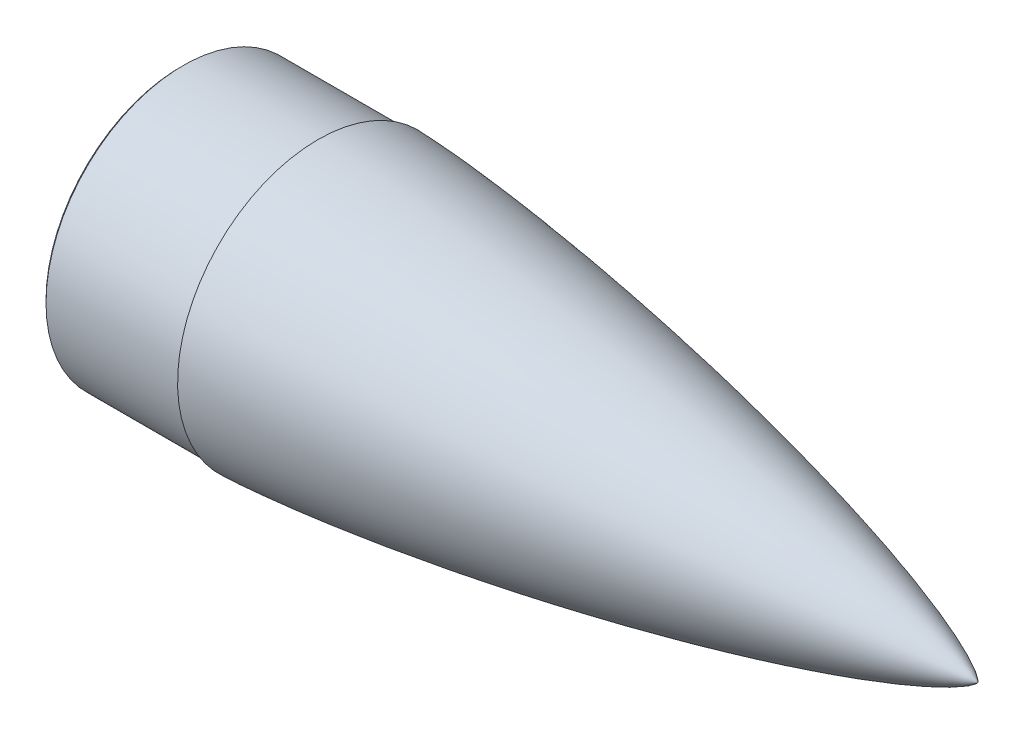
from build123d import *

# Parameters (mm, degrees)
CHAMFER1_SIZE = 1.5


with BuildPart() as part:
    # Sketch10 → Revolve1 (revolve)
    with BuildSketch(Plane.XY):
        with BuildLine():
            Line((11.112493743, 81.99983), (-84.604517473, 81.99983))
            Line((-84.604517473, 81.99983), (-84.604517473, 84.99983))
            Line((-84.604517473, 84.99983), (0.395312527, 84.99983))
            Line((0.395312527, 84.99983), (0.395312527, 86.99983))
            add(Edge.make_bspline(
                [(408.967251823, 0), (408.964913524, 0.013501739), (408.958040758, 0.039916077), (408.936520441, 0.090485698), (408.892222076, 0.174057132), (408.826281575, 0.275556803), (408.721696416, 0.415833756), (408.561101809, 0.605075245), (408.30561918, 0.87242415), (407.86966713, 1.275299562), (407.120955138, 1.885142115), (405.803773451, 2.82590185), (403.46240692, 4.287152794), (399.325294488, 6.531818454), (392.481146888, 9.758904649), (380.662076725, 14.628008466), (363.637187185, 20.711720382), (342.215241093, 27.476512989), (317.428462321, 34.49762647), (291.879335737, 41.10482439), (266.21046092, 47.228993169), (240.44548836, 52.933436777), (214.598861982, 58.255439009), (188.68089566, 63.217582693), (165.946174917, 67.253280679), (146.421982586, 70.493799722), (130.127893898, 73.044947468), (117.078590637, 74.994157933), (104.015464216, 76.84854079), (92.573263959, 78.384492045), (82.757139441, 79.635603973), (74.571340184, 80.632219902), (68.019260454, 81.400804211), (61.463723364, 82.139375899), (54.90469802, 82.84637726), (48.342159918, 83.519940506), (41.776057559, 84.15778717), (36.02754108, 84.682157239), (31.097921259, 85.105234912), (26.988317923, 85.438669825), (23.699666618, 85.693218594), (20.085807822, 85.958448038), (16.719873821, 86.189018485), (13.602098287, 86.386966779), (10.732704013, 86.554575744), (8.436635008, 86.678703291), (6.139997341, 86.792157585), (4.129892063, 86.879313264), (2.40653858, 86.944618982), (1.257348635, 86.979022496), (0.68269791, 86.99491462), (0.395312527, 86.99983)],
                knots=[0, 0, 0, 0, 0, 0.000130123, 0.000260245, 0.000520491, 0.000900391, 0.00128029, 0.001925099, 0.002881508, 0.004418208, 0.006927086, 0.011110697, 0.018279138, 0.03067276, 0.051704469, 0.08310228, 0.139908797, 0.202702513, 0.265496165, 0.328289682, 0.391083359, 0.453876973, 0.516670577, 0.579464197, 0.642257765, 0.673654596, 0.705051427, 0.736448267, 0.767845106, 0.799241874, 0.814940257, 0.830638641, 0.846337073, 0.862035505, 0.877733936, 0.893432368, 0.90913072, 0.924829072, 0.932678248, 0.940527424, 0.9483766, 0.956225776, 0.967169332, 0.97264111, 0.978112888, 0.983584666, 0.989056444, 0.994528222, 0.997264111, 1, 1, 1, 1, 1], degree=4))
            Line((408.967251823, 0), (368.967251823, 0))
            add(Edge.make_bspline(
                [(368.967251823, 0), (368.965299543, 0.012338489), (368.959416882, 0.036518378), (368.940636147, 0.082964007), (368.902304552, 0.158736421), (368.845538097, 0.250270687), (368.755690124, 0.376555746), (368.616653262, 0.54835284), (368.392888737, 0.793577299), (368.008659121, 1.164904965), (367.344738263, 1.729853685), (366.176060796, 2.601559154), (364.09282389, 3.960032328), (360.425978756, 6.040734396), (354.402196649, 9.01831007), (344.042994901, 13.507695011), (329.152005398, 19.128483965), (310.425167902, 25.398569259), (288.741266406, 31.933693508), (266.378532845, 38.106125474), (243.901379123, 43.846895186), (221.331994001, 49.212017941), (198.683967629, 54.234500927), (175.966897581, 58.934255644), (156.034567874, 62.771715365), (138.913309407, 65.864527435), (124.622146642, 68.307661522), (113.175433683, 70.17967865), (101.715073011, 71.96636138), (91.675400162, 73.451702031), (83.061477555, 74.665911128), (75.877508043, 75.636304155), (70.126883477, 76.386726745), (64.372781617, 77.110069349), (58.61515849, 77.804909351), (52.853975896, 78.469544472), (47.089163585, 79.101886687), (42.041698521, 79.62465649), (37.712905728, 80.048834251), (34.103930019, 80.384978489), (31.21573691, 80.642790078), (28.064782604, 80.911008917), (24.650683878, 81.18433613), (21.465442499, 81.419549228), (18.509298065, 81.617697726), (16.044835899, 81.767029289), (14.319122179, 81.861163774), (12.839491242, 81.933559207), (11.852734629, 81.973930117), (11.359294454, 81.99295272), (11.112493743, 81.99983)],
                knots=[0, 0, 0, 0, 0, 0.000134949, 0.000269899, 0.000539798, 0.000919537, 0.001299277, 0.001947431, 0.00293136, 0.004511869, 0.007081312, 0.011380263, 0.018707867, 0.031423867, 0.052705479, 0.084103008, 0.140910136, 0.203703492, 0.266497064, 0.329290816, 0.392084375, 0.454877964, 0.517671564, 0.580465191, 0.643258828, 0.674655593, 0.706052358, 0.737449114, 0.768845869, 0.800242661, 0.815941057, 0.831639453, 0.847337924, 0.863036395, 0.878734865, 0.894433336, 0.910131716, 0.925830096, 0.933679285, 0.941528475, 0.949377665, 0.957226855, 0.967920141, 0.978613427, 0.983960071, 0.989306714, 0.994653357, 0.997326678, 1, 1, 1, 1, 1], degree=4))
        make_face()
    revolve(axis=Axis((433.645840287, 0, 0), (-1, 0, 0)))

    # Chamfer1
    chamfer1_edges = [part.edges().sort_by_distance(p)[0] for p in [
        (-84.604517473, -84.99983, 0),
    ]]
    chamfer(chamfer1_edges, length=CHAMFER1_SIZE)


solid = part.part
